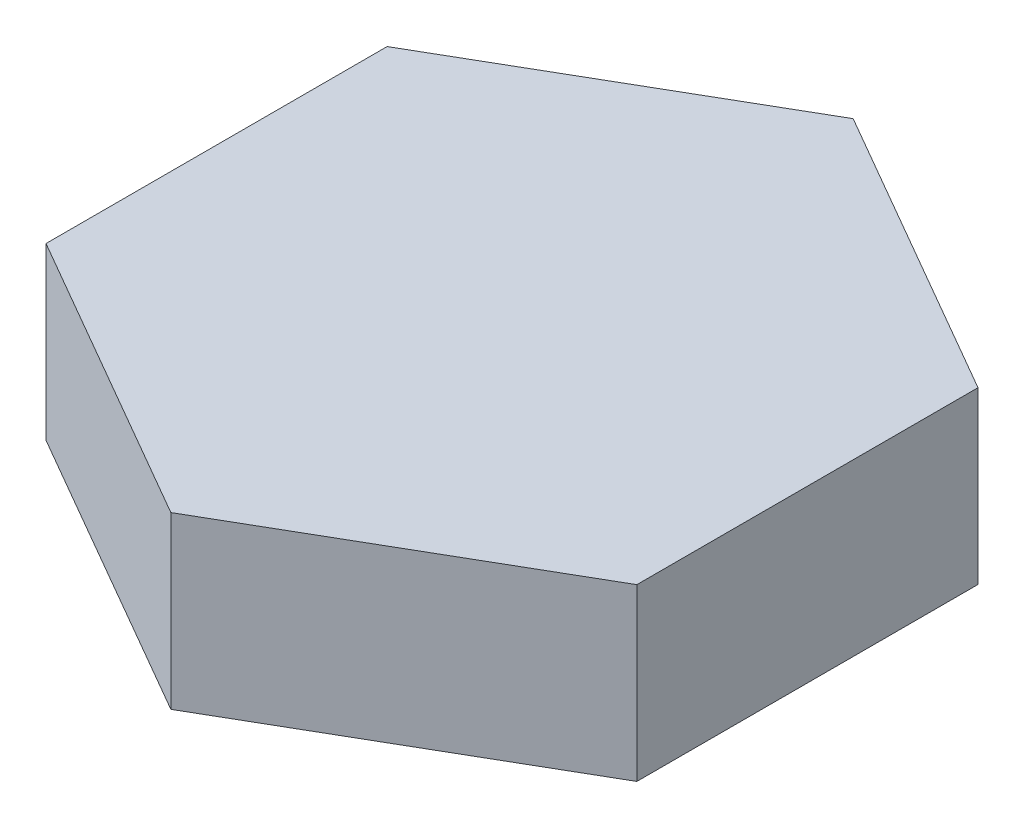
from build123d import *

# Parameters (mm, degrees)
BOSS_EXTRUDE1_DEPTH = 135


with BuildPart() as part:
    # Sketch1 → Boss-Extrude1 (new body)
    with BuildSketch(Plane(origin=(0, 0, 0), x_dir=(1, 0, 0), z_dir=(0, 1, 0))):
        Polygon((0, 270.199925981), (-234, 135.09996299), (-234, -135.09996299), (0, -270.199925981), (234, -135.09996299), (234, 135.09996299), align=None)
    extrude(amount=BOSS_EXTRUDE1_DEPTH)


solid = part.part
